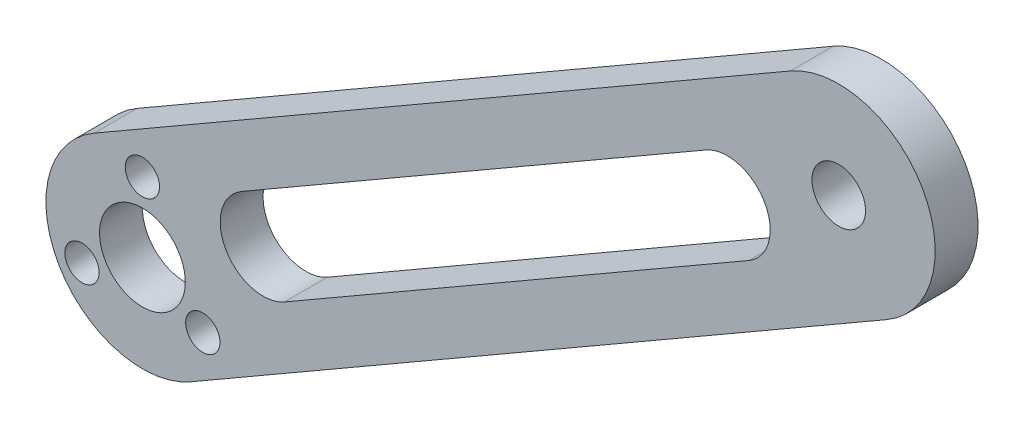
from build123d import *

# Parameters (mm, degrees)
SKETCH1_R           = 2.5
SKETCH1_R_2         = 4
SKETCH1_R_3         = 1.6
BOSS_EXTRUDE1_DEPTH = 4
CUT_EXTRUDE1_DEPTH  = 10


with BuildPart() as part:
    # Sketch1 → Boss-Extrude1 (new body)
    with BuildSketch(Plane.XY):
        with BuildLine():
            Line((4.5, -7.794228634), (69.451905284, 29.705771366))
            ThreePointArc((69.451905284, 29.705771366), (72.746133918, 42), (60.451905284, 45.294228634))
            Line((60.451905284, 45.294228634), (-4.5, 7.794228634))
            ThreePointArc((-4.5, 7.794228634), (-7.794228634, -4.5), (4.5, -7.794228634))
        make_face()
        with Locations((64.951905284, 37.5)):
            Circle(SKETCH1_R, mode=Mode.SUBTRACT)
        Circle(SKETCH1_R_2, mode=Mode.SUBTRACT)
        with Locations((0, 6.505402357)):
            Circle(SKETCH1_R_3, mode=Mode.SUBTRACT)
        with Locations((-5.633843703, -3.252701179)):
            Circle(SKETCH1_R_3, mode=Mode.SUBTRACT)
        with Locations((5.633843703, -3.252701179)):
            Circle(SKETCH1_R_3, mode=Mode.SUBTRACT)
    extrude(amount=BOSS_EXTRUDE1_DEPTH)

    # Sketch2 → Cut-Extrude1 (cut)
    with BuildSketch(Plane.XY.offset(4)):
        with BuildLine():
            Line((9.258330249, 9.964101615), (52.559600438, 34.964101615))
            ThreePointArc((52.559600438, 34.964101615), (58.023702054, 33.5), (56.559600438, 28.035898385))
            Line((56.559600438, 28.035898385), (13.258330249, 3.035898385))
            ThreePointArc((13.258330249, 3.035898385), (7.794228634, 4.5), (9.258330249, 9.964101615))
        make_face()
    extrude(amount=-CUT_EXTRUDE1_DEPTH, mode=Mode.SUBTRACT)


solid = part.part
